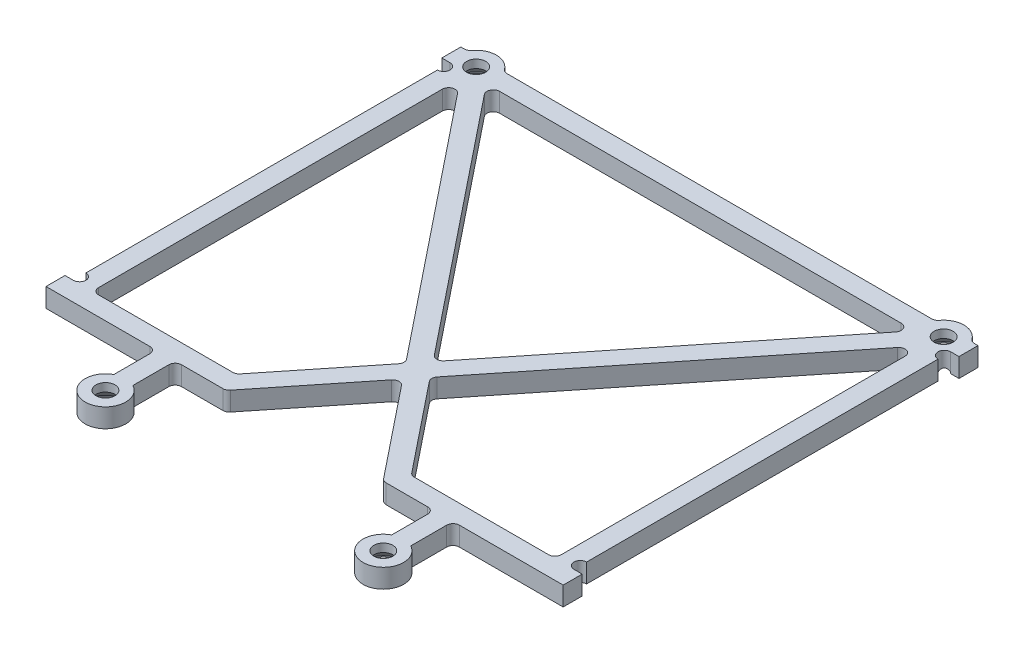
from build123d import *

# Parameters (mm, degrees)
SKETCH1_R                  = 1.5
SHAPE_DEPTH                = 3
MILL_FILLETS_R             = 1
M3_COUNTERSUNKS_AT_2_COUNT = 2
M3_COUNTERSUNKS_AT_2_PITCH = 43.84
M3_COUNTERSUNKS_AT_3_COUNT = 2
M3_COUNTERSUNKS_AT_3_PITCH = 94.086888034
M3_COUNTERSUNKS_AT_4_COUNT = 2
M3_COUNTERSUNKS_AT_4_PITCH = 74.958015582


with BuildPart() as part:
    # Sketch1 → Shape (new body)
    with BuildSketch(Plane(origin=(0, 0, 0), x_dir=(1, 0, 0), z_dir=(0, 1, 0))):
        with BuildLine():
            Line((-20.42, -27.225), (-12.393378733, -27.225))
            Line((-12.393378733, -27.225), (0, -11.743815171))
            Line((0, -11.743815171), (12.393378733, -27.225))
            Line((12.393378733, -27.225), (20.42, -27.225))
            Line((20.42, -27.225), (20.42, -33.898341195))
            ThreePointArc((20.42, -33.898341195), (21.92, -39.925), (23.42, -33.898341195))
            Line((23.42, -33.898341195), (23.42, -27.225))
            Line((23.42, -27.225), (40.8, -27.225))
            Line((40.8, -27.225), (40.8, -24.225))
            Line((40.8, -24.225), (39.5, -24.225))
            ThreePointArc((39.5, -24.225), (38.5, -23.225), (39.5, -22.225))
            Line((39.5, -22.225), (39.5, 33.225))
            ThreePointArc((39.5, 33.225), (38.5, 34.225), (39.5, 35.225))
            Line((39.5, 35.225), (40.8, 35.225))
            Line((40.8, 35.225), (40.8, 38.225))
            Line((40.8, 38.225), (39.706658805, 38.225))
            ThreePointArc((39.706658805, 38.225), (36.88, 39.925), (34.053341195, 38.225))
            Line((34.053341195, 38.225), (-34.053341195, 38.225))
            ThreePointArc((-34.053341195, 38.225), (-36.88, 39.925), (-39.706658805, 38.225))
            Line((-39.706658805, 38.225), (-40.8, 38.225))
            Line((-40.8, 38.225), (-40.8, 35.225))
            Line((-40.8, 35.225), (-39.5, 35.225))
            ThreePointArc((-39.5, 35.225), (-38.5, 34.225), (-39.5, 33.225))
            Line((-39.5, 33.225), (-39.5, -22.225))
            ThreePointArc((-39.5, -22.225), (-38.5, -23.225), (-39.5, -24.225))
            Line((-39.5, -24.225), (-40.8, -24.225))
            Line((-40.8, -24.225), (-40.8, -27.225))
            Line((-40.8, -27.225), (-23.42, -27.225))
            Line((-23.42, -27.225), (-23.42, -33.898341195))
            ThreePointArc((-23.42, -33.898341195), (-21.92, -39.925), (-20.42, -33.898341195))
            Line((-20.42, -33.898341195), (-20.42, -27.225))
        make_face()
        Polygon((-13.834640327, -24.225), (-36.5, -24.225), (-36.5, 33.850147414), (-1.921447679, -9.343639456), align=None, mode=Mode.SUBTRACT)
        with Locations((-36.88, 36.725)):
            Circle(SKETCH1_R, mode=Mode.SUBTRACT)
        with Locations((-21.92, -36.725)):
            Circle(SKETCH1_R, mode=Mode.SUBTRACT)
        Polygon((0, -6.943463741), (-33.757735438, 35.225), (33.757735438, 35.225), align=None, mode=Mode.SUBTRACT)
        Polygon((1.921447679, -9.343639456), (36.5, 33.850147414), (36.5, -24.225), (13.834640327, -24.225), align=None, mode=Mode.SUBTRACT)
        with Locations((36.88, 36.725)):
            Circle(SKETCH1_R, mode=Mode.SUBTRACT)
        with Locations((21.92, -36.725)):
            Circle(SKETCH1_R, mode=Mode.SUBTRACT)
    extrude(amount=SHAPE_DEPTH)

    # Mill fillets
    mill_fillets_edges = [part.edges().sort_by_distance(p)[0] for p in [
        (39.706658805, 1.5, -38.225),
        (34.053341195, 1.5, -38.225),
        (-39.706658805, 1.5, -38.225),
        (-34.053341195, 1.5, -38.225),
        (1.921447679, 1.5, 9.343639456),
        (-1.921447679, 1.5, 9.343639456),
        (33.757735438, 1.5, -35.225),
        (-33.757735438, 1.5, -35.225),
        (0, 1.5, 11.743815171),
        (-36.5, 1.5, 24.225),
        (13.834640327, 1.5, 24.225),
        (36.5, 1.5, 24.225),
        (-13.834640327, 1.5, 24.225),
        (36.5, 1.5, -33.850147414),
        (-36.5, 1.5, -33.850147414),
        (0, 1.5, 6.943463741),
        (-23.42, 1.5, 27.225),
        (20.42, 1.5, 27.225),
        (23.42, 1.5, 27.225),
        (-20.42, 1.5, 27.225),
        (12.393378733, 1.5, 27.225),
        (-12.393378733, 1.5, 27.225),
    ]]
    fillet(mill_fillets_edges, radius=MILL_FILLETS_R)

    # Sketch3 → M3 countersunks (revolve, cut)
    with BuildSketch(Plane(origin=(-21.92, 0, 36.725), x_dir=(0, 0, -1), z_dir=(1, 0, 0))):
        Polygon((0, 0), (0, 3), (1.5, 3), (1.5, 1.7), (3, 0.2), (3, 0), align=None)
    m3_countersunks = revolve(axis=Axis((-21.92, -6.35, 36.725), (0, 1, 0)), mode=Mode.SUBTRACT)

    # M3 countersunks at 2: M3 countersunks ×2
    with Locations(*[(i * M3_COUNTERSUNKS_AT_2_PITCH, 0, 0) for i in range(1, M3_COUNTERSUNKS_AT_2_COUNT)]):
        add(m3_countersunks, mode=Mode.SUBTRACT)

    # M3 countersunks at 3: M3 countersunks ×2
    with Locations(*[Vector(0.6249542441928148, 0, -0.7806613815639838) * (i * M3_COUNTERSUNKS_AT_3_PITCH) for i in range(1, M3_COUNTERSUNKS_AT_3_COUNT)]):
        add(m3_countersunks, mode=Mode.SUBTRACT)

    # M3 countersunks at 4: M3 countersunks ×2
    with Locations(*[Vector(-0.19957838910000314, 0, -0.9798818635959377) * (i * M3_COUNTERSUNKS_AT_4_PITCH) for i in range(1, M3_COUNTERSUNKS_AT_4_COUNT)]):
        add(m3_countersunks, mode=Mode.SUBTRACT)


solid = part.part
